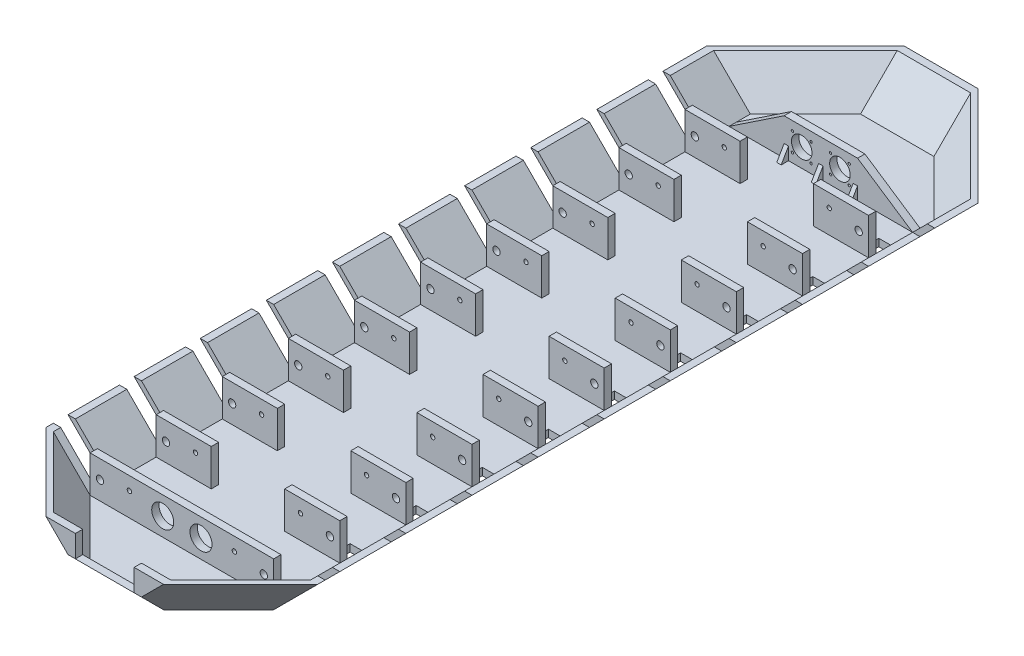
from build123d import *
from OCP.BRepAlgoAPI import BRepAlgoAPI_Cut
from OCP.TopTools import TopTools_ListOfShape

# Parameters (mm, degrees)
SKETCH1_W                = 125
SKETCH1_H                = 487
BOSS_EXTRUDE1_DEPTH      = 5
BOSS_EXTRUDE2_DEPTH      = 25
BOSS_EXTRUDE3_DEPTH      = 5
CUT_EXTRUDE3_DEPTH       = 57.99999999999998
SKETCH3_R                = 6.999999999999997
SKETCH3_R_2              = 0.7999999999999946
SKETCH3_R_3              = 0.7999999999999977
SKETCH3_R_4              = 0.7999999999996842
SKETCH3_R_5              = 0.800000000000001
SKETCH3_R_6              = 6.9999999999999964
CUT_EXTRUDE4_DEPTH       = 57.99999999999998
SKETCH7_W                = 37.500000000000036
SKETCH7_H                = 5
BOSS_EXTRUDE4_DEPTH      = 25
CUT_EXTRUDE5_DEPTH       = 492.9097986419868
CUT_EXTRUDE5_DEPTH_BACK  = 419.0000000000003
SKETCH8_R                = 1.5000000000000042
SKETCH9_R                = 2.5000000000000027
CUT_EXTRUDE7_DEPTH       = 420.0000000000003
CUT_EXTRUDE8_DEPTH       = 5
BOSS_EXTRUDE5_DEPTH      = 5
BOSS_EXTRUDE6_DEPTH      = 449.5
BOSS_EXTRUDE7_DEPTH      = 25
BOSS_EXTRUDE8_DEPTH      = 25
SKETCH16_W               = 5.0000000000000036
SKETCH16_H               = 5
BOSS_EXTRUDE9_DEPTH      = 15
BOSS_EXTRUDE10_DEPTH     = 47.7297
BOSS_EXTRUDE11_DEPTH     = 47.7297
BOSS_EXTRUDE13_DEPTH     = 49.4975
BOSS_EXTRUDE14_DEPTH     = 49.4975
CUT_EXTRUDE9_DEPTH       = 351.74955924680773
CUT_EXTRUDE9_DEPTH_BACK  = 351.74955924680773
CUT_EXTRUDE10_DEPTH      = 311.37690935610055
CUT_EXTRUDE10_DEPTH_BACK = 311.37690935610055
CUT_EXTRUDE11_DEPTH      = 329.2354534177145
CUT_EXTRUDE11_DEPTH_BACK = 329.2354534177145
CUT_EXTRUDE12_DEPTH      = 335.42265055696095
CUT_EXTRUDE12_DEPTH_BACK = 335.42265055696095
CUT_EXTRUDE13_DEPTH      = 319.07585889839424
CUT_EXTRUDE13_DEPTH_BACK = 319.07585889839424
BOSS_EXTRUDE16_DEPTH     = 5
CUT_EXTRUDE14_DEPTH      = 312.1225669345049
CUT_EXTRUDE14_DEPTH_BACK = 312.1225669345049
SKETCH45_W               = 64.4400285642806
SKETCH45_H               = 10.000000000000028
SKETCH45_W_2             = 57.09254667167651
SKETCH45_H_2             = 9.999999999999972
SKETCH45_H_3             = 10
SKETCH47_W               = 49.99999999999988
SKETCH47_H               = 4.999999999999943
BOSS_EXTRUDE17_DEPTH     = 25
SKETCH48_R               = 7.5
CUT_EXTRUDE15_DEPTH      = 52.00000000000002


with BuildPart() as part:
    # Sketch1 → Boss-Extrude1 (new body)
    with BuildSketch(Plane(origin=(0, 0, 0), x_dir=(1, 0, 0), z_dir=(0, 1, 0))):
        Rectangle(SKETCH1_W, SKETCH1_H)
    extrude(amount=BOSS_EXTRUDE1_DEPTH)

    # Sketch2 → Boss-Extrude2 (add)
    with BuildSketch(Plane(origin=(0, 5, 0), x_dir=(1, 0, 0), z_dir=(0, 1, 0))):
        Polygon((1.5000000000000062, 191.49999999999997), (22.000000000000018, 191.49999999999997), (22.000000000000014, 186.49999999999997), (25.00000000000001, 186.49999999999997), (25.00000000000001, 191.49999999999991), (25.000000000000007, 196.49999999999991), (-24.999999999999993, 196.49999999999991), (-24.999999999999996, 191.49999999999991), (-24.999999999999996, 186.49999999999991), (-22, 186.49999999999991), (-22, 191.49999999999997), (-1.4999999999999922, 191.49999999999997), (-1.4999999999999916, 186.49999999999997), (1.5000000000000084, 186.49999999999997), align=None)
    extrude(amount=BOSS_EXTRUDE2_DEPTH)

    # Sketch4 → Boss-Extrude3 (add)
    with BuildSketch(Plane.XY.offset(-191.49999999999997)):
        Polygon((-62.50000000000003, 5), (-24.999999999999993, 30.000000000000004), (-24.999999999999993, 5), align=None)
        Polygon((25.000000000000004, 30.000000000000004), (25.00000000000001, 5), (62.49999999999997, 5), align=None)
    extrude(amount=-BOSS_EXTRUDE3_DEPTH)

    # Sketch5 → Cut-Extrude3 (cut)
    with BuildSketch(Plane(origin=(25.000000000000142, 0, -1.735e-14), x_dir=(-6.9e-16, 0, -1), z_dir=(1, 0, -6.9e-16))):
        Polygon((186.49999999999994, 5), (191.49999999999994, 13.660254037844446), (191.49999999999994, 30.000000000000004), (186.49999999999994, 30.000000000000004), align=None)
    extrude(amount=-CUT_EXTRUDE3_DEPTH, mode=Mode.SUBTRACT)

    # Sketch3 → Cut-Extrude4 (cut)
    with BuildSketch(Plane.XY.offset(-191.49999999999997)):
        with Locations((-12.999999999999998, 17.500000000000004)):
            Circle(SKETCH3_R)
        with Locations((-6.636038969321078, 23.863961030678944)):
            Circle(SKETCH3_R_2)
        with Locations((-6.6360389693205475, 11.136038969321062)):
            Circle(SKETCH3_R_3)
        with Locations((-19.363961030678908, 11.136038969321058)):
            Circle(SKETCH3_R_4)
        with Locations((-19.363961030678876, 23.863961030678457)):
            Circle(SKETCH3_R_5)
        with Locations((19.363961030678922, 11.136038969321058)):
            Circle(SKETCH3_R_4)
        with Locations((6.636038969320562, 11.136038969321062)):
            Circle(SKETCH3_R_3)
        with Locations((6.636038969321092, 23.863961030678944)):
            Circle(SKETCH3_R_2)
        with Locations((13.00000000000001, 17.500000000000004)):
            Circle(SKETCH3_R_6)
        with Locations((19.36396103067889, 23.863961030678457)):
            Circle(SKETCH3_R_5)
    extrude(amount=-CUT_EXTRUDE4_DEPTH, mode=Mode.SUBTRACT)

    # Sketch7 → Boss-Extrude4 (add)
    with BuildSketch(Plane(origin=(0, 5, 0), x_dir=(1, 0, 0), z_dir=(0, 1, 0))):
        Polygon((-62.50000000000003, -238.49999999999997), (-62.50000000000003, -243.49999999999997), (-24.999999999999943, -243.50000000000003), (-24.99999999999994, -238.50000000000003), align=None)
        with Locations((-43.750000000000014, 164.00000000000003)):
            Rectangle(SKETCH7_W, SKETCH7_H)
        Polygon((-62.50000000000003, 121.50000000000003), (-62.50000000000003, 116.50000000000001), (-24.999999999999986, 116.49999999999997), (-24.999999999999982, 121.49999999999997), align=None)
        Polygon((-62.50000000000003, 76.50000000000003), (-62.50000000000003, 71.50000000000003), (-24.999999999999986, 71.49999999999997), (-24.999999999999982, 76.49999999999997), align=None)
        Polygon((-62.50000000000003, 31.50000000000002), (-62.50000000000003, 26.500000000000025), (-24.99999999999997, 26.499999999999968), (-24.999999999999975, 31.499999999999957), align=None)
        Polygon((-62.50000000000003, -13.499999999999973), (-62.50000000000003, -18.499999999999975), (-24.99999999999997, -18.500000000000032), (-24.999999999999968, -13.50000000000003), align=None)
        Polygon((-62.50000000000003, -58.49999999999997), (-62.50000000000003, -63.49999999999997), (-24.99999999999997, -63.50000000000003), (-24.99999999999996, -58.50000000000003), align=None)
        Polygon((-62.50000000000003, -103.49999999999997), (-62.50000000000003, -108.49999999999997), (-24.999999999999957, -108.50000000000003), (-24.999999999999954, -103.50000000000003), align=None)
        Polygon((-62.50000000000003, -148.49999999999997), (-62.50000000000003, -153.49999999999997), (-24.999999999999957, -153.50000000000003), (-24.999999999999954, -148.50000000000003), align=None)
        Polygon((-62.50000000000003, -193.49999999999994), (-62.50000000000003, -198.49999999999994), (-24.999999999999943, -198.5), (-24.999999999999947, -193.5), align=None)
        Polygon((25.000000000000014, 161.50000000000003), (62.50000000000006, 161.50000000000006), (62.50000000000006, 166.50000000000006), (25.000000000000014, 166.50000000000003), align=None)
        Polygon((24.999999999999986, 116.49999999999997), (62.50000000000006, 116.50000000000003), (62.50000000000006, 121.50000000000004), (24.999999999999986, 121.49999999999997), align=None)
        Polygon((24.999999999999986, 71.49999999999997), (62.500000000000085, 71.50000000000004), (62.50000000000006, 76.50000000000004), (24.999999999999986, 76.49999999999997), align=None)
        Polygon((24.99999999999997, 26.499999999999968), (62.500000000000085, 26.50000000000004), (62.500000000000085, 31.500000000000036), (24.99999999999997, 31.499999999999957), align=None)
        Polygon((24.99999999999997, -18.500000000000032), (62.500000000000085, -18.49999999999996), (62.500000000000085, -13.499999999999957), (24.99999999999997, -13.50000000000003), align=None)
        Polygon((24.99999999999997, -63.50000000000003), (62.500000000000114, -63.49999999999996), (62.500000000000114, -58.49999999999996), (24.999999999999957, -58.50000000000003), align=None)
        Polygon((24.999999999999957, -108.50000000000003), (62.500000000000114, -108.49999999999996), (62.500000000000114, -103.49999999999996), (24.999999999999957, -103.50000000000003), align=None)
        Polygon((24.999999999999957, -153.50000000000003), (62.50000000000014, -153.49999999999994), (62.500000000000114, -148.49999999999994), (24.999999999999957, -148.50000000000003), align=None)
        Polygon((24.999999999999943, -198.5), (62.50000000000014, -198.49999999999991), (62.50000000000014, -193.49999999999991), (24.999999999999943, -193.5), align=None)
        Polygon((24.99999999999994, -238.50000000000003), (24.99999999999994, -243.50000000000003), (62.50000000000014, -243.49999999999994), (62.50000000000014, -238.49999999999994), align=None)
    extrude(amount=BOSS_EXTRUDE4_DEPTH)

    # Sketch8 → Cut-Extrude5 (cut, two sides: drawn at the far end of the back side and taken through both)
    with BuildSketch(Plane.XY.offset(243.49999999999997).offset(-CUT_EXTRUDE5_DEPTH_BACK)):
        with Locations((-35.732135843338604, 20.999999999999996)):
            Circle(SKETCH8_R)
        with Locations((35.732135843338604, 21.000000000000007)):
            Circle(SKETCH8_R)
    extrude(amount=CUT_EXTRUDE5_DEPTH + CUT_EXTRUDE5_DEPTH_BACK, mode=Mode.SUBTRACT)

    # Sketch9 → Cut-Extrude7 (cut)
    with BuildSketch(Plane.XY.offset(243.49999999999997)):
        with Locations((-55.78264612293527, 17.500000000000004)):
            Circle(SKETCH9_R)
        with Locations((55.78264612293528, 17.49999999999999)):
            Circle(SKETCH9_R)
    extrude(amount=-CUT_EXTRUDE7_DEPTH, mode=Mode.SUBTRACT)

    # Sketch10 → Cut-Extrude8 (cut)
    with BuildSketch(Plane(origin=(0, 5, 0), x_dir=(1, 0, 0), z_dir=(0, 1, 0))):
        Polygon((62.49999999999997, 243.50000000000003), (25.000000000000007, 243.50000000000003), (62.49999999999997, 205.99999999999966), align=None)
        Polygon((-24.999999999999993, 243.50000000000003), (-62.50000000000003, 243.50000000000003), (-62.50000000000003, 205.99999999999986), align=None)
    extrude(amount=-CUT_EXTRUDE8_DEPTH, mode=Mode.SUBTRACT)

    # Sketch11 → Boss-Extrude5 (add)
    with BuildSketch(Plane(origin=(0, 5, 0), x_dir=(1, 0, 0), z_dir=(0, 1, 0))):
        Polygon((-62.50000000000003, -243.49999999999997), (-24.99999999999993, -281), (25.000000000000078, -281), (62.49999999999997, -243.49999999999997), align=None)
    extrude(amount=-BOSS_EXTRUDE5_DEPTH)

    # Sketch13 → Boss-Extrude6 (add)
    with BuildSketch(Plane.XY.offset(243.49999999999997)):
        Polygon((-92.50000000000038, 30), (-62.50000000000003, 0), (-62.50000000000003, 5), (-87.50000000000033, 30), align=None)
        Polygon((87.50000000000033, 30.00000000000002), (62.50000000000014, 5.000000000000313), (62.50000000000016, 3.1264e-13), (92.50000000000038, 30.000000000000025), align=None)
    extrude(amount=-BOSS_EXTRUDE6_DEPTH)

    # Sketch14 → Boss-Extrude7 (add, symmetric)
    with BuildSketch(Plane(origin=(0, 0, 0), x_dir=(0, 0, -1), z_dir=(1, 0, 0))):
        Polygon((243.50000000000003, 0), (273.5, 30.000000000000025), (268.5, 30.000000000000025), (243.50000000000003, 5), align=None)
    extrude(amount=BOSS_EXTRUDE7_DEPTH, both=True)

    # Sketch15 → Boss-Extrude8 (add, symmetric)
    with BuildSketch(Plane(origin=(0, 0, 0), x_dir=(0, 0, -1), z_dir=(1, 0, 0))):
        Polygon((-281, 0), (-296.0000000000002, 15.000000000000169), (-291.0000000000002, 15.000000000000169), (-281, 5), align=None)
    extrude(amount=BOSS_EXTRUDE8_DEPTH, both=True)

    # Sketch16 → Boss-Extrude9 (add)
    with BuildSketch(Plane(origin=(0, 15.000000000000169, 0), x_dir=(1, 0, 0), z_dir=(0, 1, 0))):
        with Locations((-22.5, -293.5000000000002)):
            Rectangle(SKETCH16_W, SKETCH16_H)
        with Locations((22.5, -293.5000000000002)):
            Rectangle(SKETCH16_W, SKETCH16_H)
    extrude(amount=BOSS_EXTRUDE9_DEPTH)

    # Sketch23 → Boss-Extrude10 (add, symmetric)
    with BuildSketch(Plane(origin=(-90.50000000000021, -1.25594e-12, -90.50000000000115), x_dir=(2.78e-15, -1, 1.11e-14), z_dir=(0.7071067811865438, 9.813077866773626e-15, 0.7071067811865513))):
        Polygon((-5.000000000002531, 189.85817074858713), (-30.000000000002053, 207.5358402782508), (-30.000000000002053, 211.07137418418415), (-2.42931e-12, 189.85817074858764), align=None)
    extrude(amount=BOSS_EXTRUDE10_DEPTH, both=True)

    # Sketch28 → Boss-Extrude11 (add, symmetric)
    with BuildSketch(Plane(origin=(90.50000000000003, 0, -90.5000000000004), x_dir=(0, -1, 0), z_dir=(0.7071067811865462, 0, -0.7071067811865489))):
        Polygon((-5, 189.85817074858778), (-29.999999776424065, 207.53584012015935), (-30.000000000000025, 211.07137418418415), (0, 189.85817074858775), align=None)
    extrude(amount=BOSS_EXTRUDE11_DEPTH, both=True)

    # Sketch30 → Boss-Extrude13 (add, symmetric)
    with BuildSketch(Plane(origin=(-110.49999999999997, 0, 110.50000000000047), x_dir=(0, -1, 0), z_dir=(-0.7071067811865459, 0, 0.7071067811865492))):
        Polygon((0, 216.37467504308322), (-30.000000000000025, 237.58787847867995), (-30.00000000000003, 234.05234457274722), (-4.999999999999961, 216.3746750430832), align=None)
    extrude(amount=BOSS_EXTRUDE13_DEPTH, both=True)

    # Sketch32 → Boss-Extrude14 (add, symmetric)
    with BuildSketch(Plane(origin=(110.5, 0, 110.49999999999987), x_dir=(0, -1, 0), z_dir=(-0.7071067811865479, 0, -0.7071067811865471))):
        Polygon((0, 216.3746750430836), (-30, 237.5878784786803), (-29.99999995622837, 234.0523445417963), (-5, 216.3746750430836), align=None)
    extrude(amount=BOSS_EXTRUDE14_DEPTH, both=True)


with BuildPart() as cut_extrude9_tool:
    # Sketch34 → Cut-Extrude9 (new, two sides: drawn at the far end of the back side and taken through both)
    with BuildSketch(Plane(origin=(0, 0, 63.49999999999997), x_dir=(0, -1, 0), z_dir=(0, 0, -1)).offset(-CUT_EXTRUDE9_DEPTH_BACK)):
        Polygon((-3.47e-15, 62.49999999999987), (0, 77.49999453399953), (-29.99999606493027, 92.49999256646467), align=None)
    extrude(amount=CUT_EXTRUDE9_DEPTH + CUT_EXTRUDE9_DEPTH_BACK)


with BuildPart() as part_1:
    add(part.part)

    # Cut-Extrude9: cut by cut_extrude9_tool, with a tolerance
    cut_extrude9_stock = TopTools_ListOfShape()
    cut_extrude9_stock.Append(part_1.part.wrapped)
    cut_extrude9_tools = TopTools_ListOfShape()
    cut_extrude9_tools.Append(cut_extrude9_tool.part.wrapped)
    cut_extrude9_cut = BRepAlgoAPI_Cut()
    cut_extrude9_cut.SetArguments(cut_extrude9_stock)
    cut_extrude9_cut.SetTools(cut_extrude9_tools)
    cut_extrude9_cut.SetFuzzyValue(0.00001)
    cut_extrude9_cut.Build()
    add(Compound.cast(cut_extrude9_cut.Shape()).solids(), mode=Mode.REPLACE)


with BuildPart() as cut_extrude9_kept_piece:
    # of the separate pieces the step leaves, the one the design keeps (cut_extrude9_pieces_kept)
    add(part_1.part.solids().sort_by_distance((-62.5, 5, 238.5))[0])

    # Sketch36 → Cut-Extrude10 (cut, two sides: drawn at the far end of the back side and taken through both)
    with BuildSketch(Plane(origin=(0, 8.39145985337e-06, 18.749999999996206), x_dir=(0, -0.9999999999998999, 4.4754452551324405e-07), z_dir=(0, 4.4754452551324405e-07, 0.9999999999998999)).offset(-CUT_EXTRUDE10_DEPTH_BACK)):
        Polygon((0.00010897709164676, 62.50000000000016), (0.00010226391606793, 77.5000179017812), (-29.999891022917065, 92.50000895089092), align=None)
    extrude(amount=CUT_EXTRUDE10_DEPTH + CUT_EXTRUDE10_DEPTH_BACK, mode=Mode.SUBTRACT)


with BuildPart() as cut_extrude10_kept_piece:
    # of the separate pieces the step leaves, the one the design keeps (cut_extrude10_pieces_kept)
    add(cut_extrude9_kept_piece.part.solids().sort_by_distance((62.5, 5, 243.5))[0])


with BuildPart() as cut_extrude11_tool:
    # Sketch38 → Cut-Extrude11 (new, two sides: drawn at the far end of the back side and taken through both)
    with BuildSketch(Plane(origin=(0, 0, 0), x_dir=(-6.441743947732422e-08, 0.7071067811865465, -0.7071067811865458), z_dir=(-0.999999999999996, -9.11000165621797e-08, 0)).offset(-CUT_EXTRUDE11_DEPTH_BACK)):
        Polygon((172.18050282935994, 172.18049960848884), (182.78709971585087, 182.78709842750231), (214.60690583550704, 172.18049574344266), align=None)
    extrude(amount=CUT_EXTRUDE11_DEPTH + CUT_EXTRUDE11_DEPTH_BACK)


with BuildPart() as cut_extrude10_kept_piece_1:
    add(cut_extrude10_kept_piece.part)

    # Cut-Extrude11: cut by cut_extrude11_tool, with a tolerance
    cut_extrude11_stock = TopTools_ListOfShape()
    cut_extrude11_stock.Append(cut_extrude10_kept_piece_1.part.wrapped)
    cut_extrude11_tools = TopTools_ListOfShape()
    cut_extrude11_tools.Append(cut_extrude11_tool.part.wrapped)
    cut_extrude11_cut = BRepAlgoAPI_Cut()
    cut_extrude11_cut.SetArguments(cut_extrude11_stock)
    cut_extrude11_cut.SetTools(cut_extrude11_tools)
    cut_extrude11_cut.SetFuzzyValue(0.00001)
    cut_extrude11_cut.Build()
    add(Compound.cast(cut_extrude11_cut.Shape()).solids(), mode=Mode.REPLACE)

    # Sketch40 → Cut-Extrude12 (cut, two sides: drawn at the far end of the back side and taken through both)
    with BuildSketch(Plane(origin=(-19.999982076333133, 0, 0), x_dir=(0, -1, 0), z_dir=(-1, 0, 0)).offset(-CUT_EXTRUDE12_DEPTH_BACK)):
        Polygon((-30.000000000000167, 296.0000000000002), (-29.999999999999996, 313.5000179017813), (0, 298.5000179017812), (0, 296.0000000000002), (-15.000000000000167, 296.0000000000002), align=None)
    extrude(amount=CUT_EXTRUDE12_DEPTH + CUT_EXTRUDE12_DEPTH_BACK, mode=Mode.SUBTRACT)

    # Sketch42 → Cut-Extrude13 (cut, two sides: drawn at the far end of the back side and taken through both)
    with BuildSketch(Plane(origin=(-20, 0, 0), x_dir=(0, 0, -1), z_dir=(1, 0, 0)).offset(-CUT_EXTRUDE13_DEPTH_BACK)):
        Polygon((-296.0000000000002, 14.999999978114186), (-281, 0), (-296.0000000000002, 0), align=None)
    extrude(amount=CUT_EXTRUDE13_DEPTH + CUT_EXTRUDE13_DEPTH_BACK, mode=Mode.SUBTRACT)

    # Sketch43 → Boss-Extrude16 (add)
    with BuildSketch(Plane.XY.offset(296.0000000000002)):
        Polygon((-40.00000000000005, 30.000000000000163), (-24.999999978114097, 14.999999978114186), (-25, 30.00000000000017), align=None)
        Polygon((25, 30.00000000000017), (24.99999997811435, 14.999999978114186), (40.000000000000426, 30.000000000000163), align=None)
    extrude(amount=-BOSS_EXTRUDE16_DEPTH)

    # Sketch45 → Cut-Extrude14 (cut, two sides: drawn at the far end of the back side and taken through both)
    with BuildSketch(Plane(origin=(0, 5, 0), x_dir=(1, 0, 0), z_dir=(0, 1, 0)).offset(-CUT_EXTRUDE14_DEPTH_BACK)):
        with Locations((-86.72001428214031, -233.49999999999994)):
            Rectangle(SKETCH45_W, SKETCH45_H)
        Polygon((111.59254667167664, -238.49999999999997), (111.59254667167664, -228.49999999999994), (54.50000000000014, -228.49999999999994), (54.50000000000014, -238.49999999999994), align=None)
        Polygon((-118.94002856428061, -193.49999999999994), (-54.50000000000003, -193.49999999999997), (-54.50000000000003, -183.49999999999997), (-118.94002856428061, -183.49999999999997), align=None)
        with Locations((83.04627333583839, -188.49999999999994)):
            Rectangle(SKETCH45_W_2, SKETCH45_H_2)
        Polygon((-118.94002856428061, -148.49999999999997), (-54.50000000000003, -148.5), (-54.50000000000003, -138.49999999999997), (-118.94002856428061, -138.49999999999997), align=None)
        with Locations((83.04627333583839, -143.49999999999997)):
            Rectangle(SKETCH45_W_2, SKETCH45_H_3)
        Polygon((-118.94002856428061, -103.49999999999996), (-54.50000000000003, -103.50000000000001), (-54.50000000000003, -93.5), (-118.94002856428061, -93.5), align=None)
        Polygon((111.59254667167664, -103.49999999999996), (111.59254667167664, -93.5), (54.50000000000014, -93.5), (54.50000000000014, -103.49999999999999), align=None)
        Polygon((-118.94002856428061, -58.49999999999997), (-54.50000000000003, -58.50000000000002), (-54.50000000000003, -48.500000000000014), (-118.94002856428061, -48.500000000000014), align=None)
        Polygon((111.59254667167664, -58.49999999999997), (111.59254667167664, -48.500000000000014), (54.50000000000014, -48.500000000000014), (54.50000000000014, -58.5), align=None)
        Polygon((-118.94002856428061, -13.499999999999984), (-54.50000000000003, -13.500000000000039), (-54.50000000000003, -3.500000000000031), (-118.94002856428061, -3.500000000000031), align=None)
        Polygon((111.59254667167664, -13.499999999999986), (111.59254667167664, -3.500000000000031), (54.50000000000014, -3.500000000000031), (54.50000000000014, -13.500000000000012), align=None)
        Polygon((-118.94002856428061, 31.500000000000057), (-54.50000000000003, 31.499999999999943), (-54.50000000000003, 41.49999999999995), (-118.94002856428061, 41.49999999999995), align=None)
        Polygon((111.59254667167664, 31.500000000000057), (111.59254667167664, 41.49999999999995), (54.50000000000014, 41.49999999999995), (54.50000000000014, 31.49999999999997), align=None)
        Polygon((-118.94002856428061, 76.50000000000004), (-54.50000000000003, 76.49999999999993), (-54.50000000000003, 86.49999999999994), (-118.94002856428061, 86.49999999999994), align=None)
        Polygon((111.59254667167664, 76.50000000000004), (111.59254667167664, 86.49999999999994), (54.50000000000014, 86.49999999999994), (54.50000000000014, 76.49999999999996), align=None)
        Polygon((-118.94002856428061, 121.50000000000003), (-54.50000000000003, 121.49999999999991), (-54.50000000000003, 131.49999999999991), (-118.94002856428061, 131.49999999999991), align=None)
        Polygon((111.59254667167664, 121.50000000000003), (111.59254667167664, 131.49999999999991), (54.50000000000014, 131.49999999999991), (54.50000000000014, 121.49999999999994), align=None)
        Polygon((-118.94002856428061, 166.5), (-54.50000000000003, 166.4999999999999), (-54.50000000000003, 176.49999999999991), (-118.94002856428061, 176.49999999999991), align=None)
        Polygon((111.59254667167664, 166.5), (111.59254667167664, 176.49999999999991), (54.50000000000014, 176.49999999999991), (54.50000000000014, 166.49999999999991), align=None)
    extrude(amount=CUT_EXTRUDE14_DEPTH + CUT_EXTRUDE14_DEPTH_BACK, mode=Mode.SUBTRACT)

    # Sketch47 → Boss-Extrude17 (add)
    with BuildSketch(Plane(origin=(0, 5, 0), x_dir=(1, 0, 0), z_dir=(0, 1, 0))):
        with Locations((0, -241)):
            Rectangle(SKETCH47_W, SKETCH47_H)
    extrude(amount=BOSS_EXTRUDE17_DEPTH)

    # Sketch48 → Cut-Extrude15 (cut)
    with BuildSketch(Plane.XY.offset(243.49999999999997)):
        with Locations((13.023999241815046, 17.50708305216322)):
            Circle(SKETCH48_R)
        with Locations((-13.023999241815066, 17.507083052163182)):
            Circle(SKETCH48_R)
    extrude(amount=-CUT_EXTRUDE15_DEPTH, mode=Mode.SUBTRACT)


solid = cut_extrude10_kept_piece_1.part
